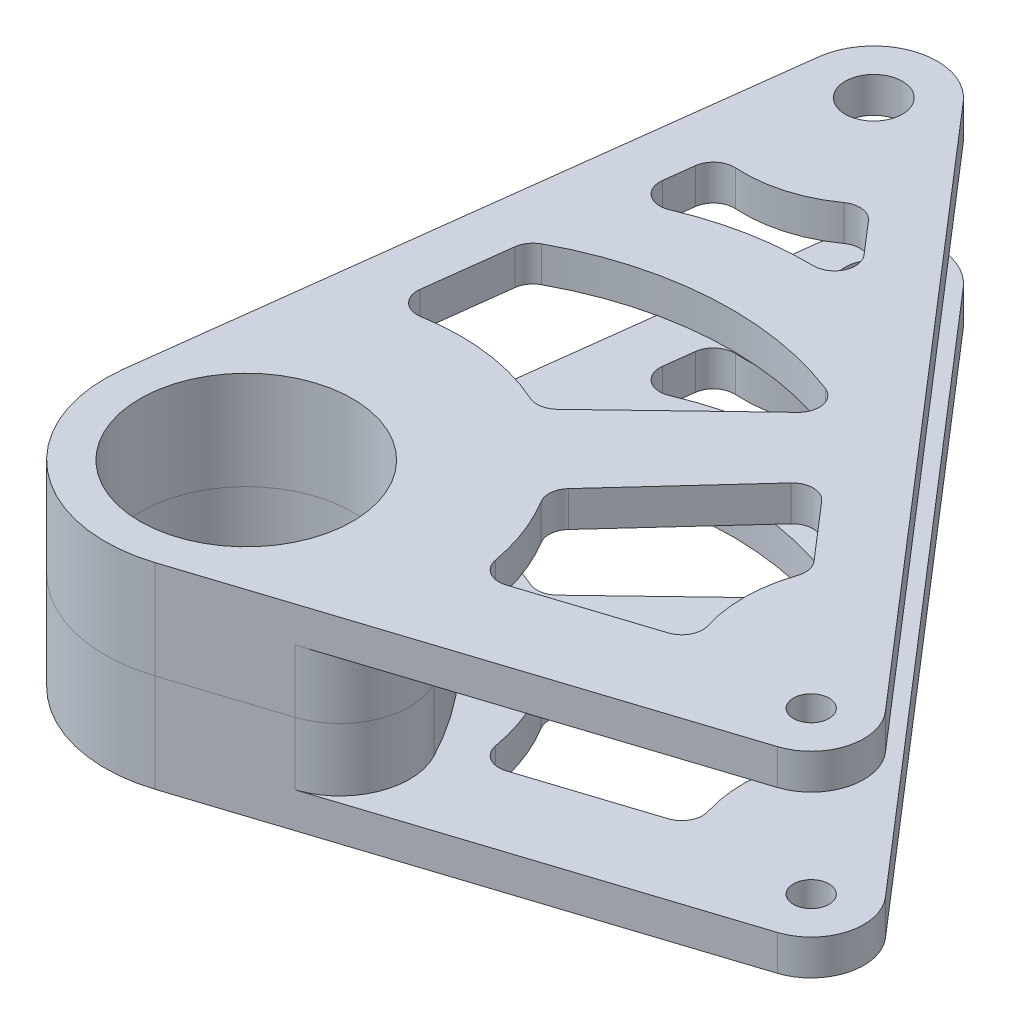
from build123d import *

# Parameters (mm, degrees)
SKETCH1_R           = 4.1
SKETCH1_R_2         = 15.25
SKETCH1_R_3         = 2.55
BOSS_EXTRUDE1_DEPTH = 5.08
CUT_EXTRUDE1_DEPTH  = 127.772689617
SKETCH2_R           = 15.25
BOSS_EXTRUDE2_DEPTH = 9


with BuildPart() as part:
    # Sketch1 → Boss-Extrude1 (new body)
    with BuildSketch(Plane(origin=(0, 0, 0), x_dir=(1, 0, 0), z_dir=(0, 1, 0))):
        with BuildLine():
            ThreePointArc((6.890077493, 95.944479131), (-2.63548739, 98.710006097), (-9.029894479, 91.127388889))
            Line((-9.029894479, 91.127388889), (-20.093995955, 2.50875))
            ThreePointArc((-20.093995955, 2.50875), (-12.912354446, -15.599153908), (6.218389981, -19.271588571))
            Line((6.218389981, -19.271588571), (73.665219512, 2.491572648))
            ThreePointArc((73.665219512, 2.491572648), (78.616322005, 7.638169923), (77.063250927, 14.608740175))
            Line((77.063250927, 14.608740175), (6.890077493, 95.944479131))
        make_face()
        with Locations((0, 90)):
            Circle(SKETCH1_R, mode=Mode.SUBTRACT)
        Circle(SKETCH1_R_2, mode=Mode.SUBTRACT)
        with Locations((71.346758062, 9.676782214)):
            Circle(SKETCH1_R_3, mode=Mode.SUBTRACT)
    extrude(amount=BOSS_EXTRUDE1_DEPTH)

    # Sketch3 → Cut-Extrude1 (cut, through all)
    with BuildSketch(Plane(origin=(0, 5.08, 0), x_dir=(1, 0, 0), z_dir=(0, 1, 0))):
        with BuildLine():
            ThreePointArc((-1.188600638, 71.375391145), (-3.292581933, 70.69249065), (-4.356556701, 68.753148476))
            Line((-4.356556701, 68.753148476), (-4.878020737, 64.576448434))
            ThreePointArc((-4.878020737, 64.576448434), (-3.708811856, 61.810560567), (-0.728471883, 61.44346556))
            ThreePointArc((-0.728471883, 61.44346556), (7.720260117, 64.027850259), (16.521726722, 64.798760283))
            ThreePointArc((16.521726722, 64.798760283), (19.290458184, 66.525487483), (18.845309719, 69.75802574))
            Line((18.845309719, 69.75802574), (14.885007874, 74.348299505))
            ThreePointArc((14.885007874, 74.348299505), (12.968841591, 75.367468579), (10.866725596, 74.827554538))
            ThreePointArc((10.866725596, 74.827554538), (5.137692449, 72.058624836), (-1.188600638, 71.375391145))
        make_face()
        with BuildLine():
            ThreePointArc((-5.677881511, 48.029040036), (-6.726963902, 47.08325842), (-7.226986648, 45.762253506))
            Line((-7.226986648, 45.762253506), (-8.738079703, 33.659055608))
            ThreePointArc((-8.738079703, 33.659055608), (-7.83189665, 31.116633353), (-5.249574652, 30.331336119))
            ThreePointArc((-5.249574652, 30.331336119), (3.894764017, 30.534878386), (12.695228432, 28.042452814))
            ThreePointArc((12.695228432, 28.042452814), (14.437464993, 27.81823954), (16.006569979, 28.607903624))
            Line((16.006569979, 28.607903624), (33.618181716, 45.460220454))
            ThreePointArc((33.618181716, 45.460220454), (34.486605252, 48.21227384), (32.632245235, 50.423451401))
            ThreePointArc((32.632245235, 50.423451401), (13.213483803, 53.44536455), (-5.677881511, 48.029040036))
        make_face()
        with BuildLine():
            Line((34.170784995, 3.120696118), (51.736367836, 8.788606884))
            ThreePointArc((51.736367836, 8.788606884), (53.477780306, 10.261533294), (53.68016918, 12.533331777))
            ThreePointArc((53.68016918, 12.533331777), (52.76362023, 18.881112777), (53.861203599, 25.200107661))
            ThreePointArc((53.861203599, 25.200107661), (53.968146531, 26.741093636), (53.29420901, 28.131015498))
            Line((53.29420901, 28.131015498), (46.37648492, 36.149153673))
            ThreePointArc((46.37648492, 36.149153673), (44.148577926, 37.189119203), (41.891421306, 36.214264407))
            Line((41.891421306, 36.214264407), (26.659757364, 19.562510711))
            ThreePointArc((26.659757364, 19.562510711), (25.887621459, 17.829784995), (26.309296792, 15.980265552))
            ThreePointArc((26.309296792, 15.980265552), (28.789086859, 10.896626204), (30.296850168, 5.445076187))
            ThreePointArc((30.296850168, 5.445076187), (31.706045406, 3.403273116), (34.170784995, 3.120696118))
        make_face()
    extrude(amount=-CUT_EXTRUDE1_DEPTH, mode=Mode.SUBTRACT)

    # Sketch2 → Boss-Extrude2 (add)
    with BuildSketch(Plane(origin=(0, 5.08, 0), x_dir=(1, 0, 0), z_dir=(0, 1, 0))):
        with BuildLine():
            Line((6.218389981, -19.271588571), (21.357687544, -14.386570611))
            ThreePointArc((21.357687544, -14.386570611), (27.540014283, -8.66176298), (27.153114967, -0.244822013))
            ThreePointArc((27.153114967, -0.244822013), (13.695293271, 16.517669127), (-5.138881409, 26.879519257))
            ThreePointArc((-5.138881409, 26.879519257), (-13.557028377, 25.768868593), (-18.086633724, 18.586848079))
            Line((-18.086633724, 18.586848079), (-20.093995955, 2.50875))
            ThreePointArc((-20.093995955, 2.50875), (-12.912354446, -15.599153908), (6.218389981, -19.271588571))
        make_face()
        Circle(SKETCH2_R, mode=Mode.SUBTRACT)
    extrude(amount=BOSS_EXTRUDE2_DEPTH)


with BuildPart() as body_2:
    # Mirror1: mirrored copy
    add(part.part.mirror(Plane.ZX.offset(14.08)))


solid = Compound([part.part, body_2.part])
